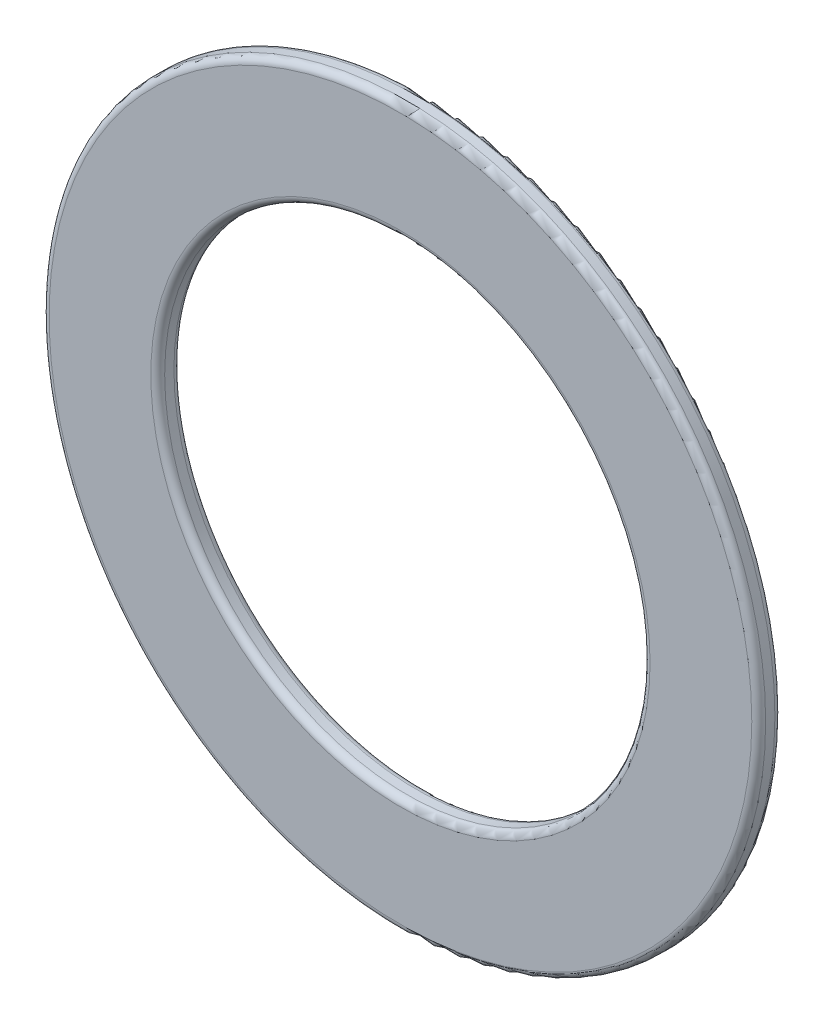
from build123d import *

# Parameters (mm, degrees)
SKETCH1_R          = 7.75
SKETCH1_R_2        = 5.25
BASE_FLANGE1_DEPTH = 0.5
FILLET1_R          = 0.15


# Sheet-metal steps are written as plain solids
with BuildPart() as part:
    # Sketch1 → Base-Flange1 (new body)
    with BuildSketch(Plane.XY):
        Circle(SKETCH1_R)
        Circle(SKETCH1_R_2, mode=Mode.SUBTRACT)
    extrude(amount=-BASE_FLANGE1_DEPTH)

    # Fillet1
    fillet1_edges = [part.edges().sort_by_distance(p)[0] for p in [
        (-7.75, 0, 0),
        (-7.75, 0, -0.5),
        (-5.25, 0, -0.5),
        (-5.25, 0, 0),
    ]]
    fillet(fillet1_edges, radius=FILLET1_R)


solid = part.part
